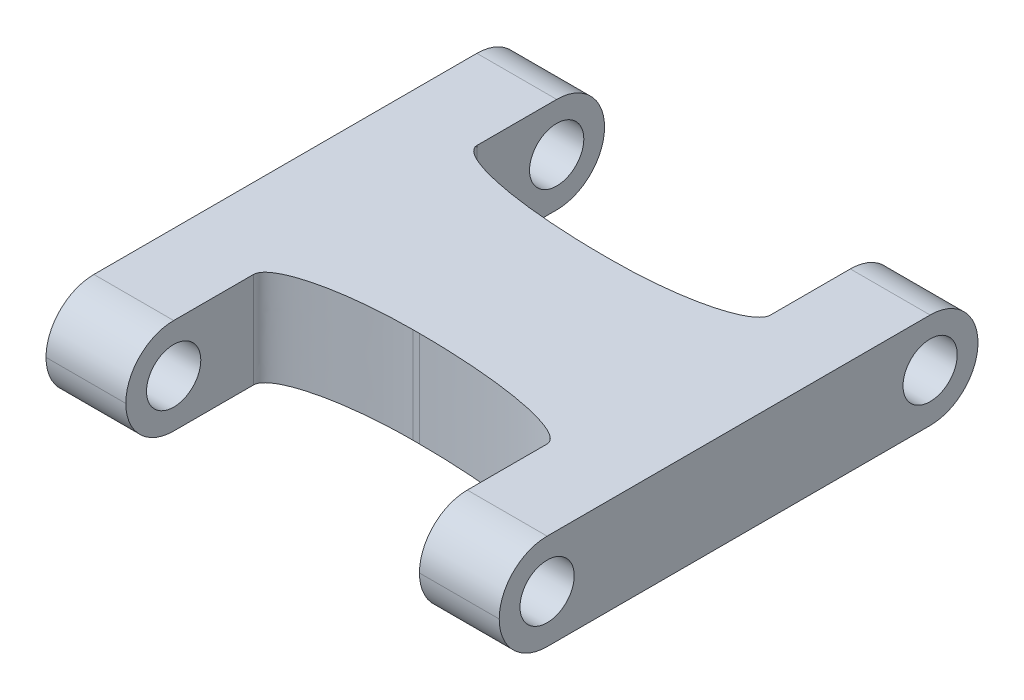
from build123d import *

# Parameters (mm, degrees)
BOSS_EXTRUDE1_DEPTH = 6
FILLET1_R           = 3
SKETCH2_R           = 1.7
CUT_EXTRUDE1_DEPTH  = 42.743981602
FILLET2_SIZE        = 8
FILLET2_SIZE_2      = 2
FILLET3_SIZE        = 2
FILLET3_SIZE_2      = 10


# Some blends are built 0.0001 mm under size
with BuildPart() as part:
    # Sketch1 → Boss-Extrude1 (new body)
    with BuildSketch(Plane(origin=(0, 0, 0), x_dir=(1, 0, 0), z_dir=(0, 1, 0))):
        Polygon((0, 0), (0, 30), (5, 30), (5, 20), (23.4, 20), (23.4, 30), (28.4, 30), (28.4, 0), (23.4, 0), (23.4, 10), (5, 10), (5, 0), align=None)
    extrude(amount=BOSS_EXTRUDE1_DEPTH)

    # Fillet1
    fillet1_edges = [part.edges().sort_by_distance(p)[0] for p in [
        (2.5, 0, -30),
        (2.5, 6, -30),
        (25.9, 0, -30),
        (25.9, 6, -30),
        (2.5, 0, 0),
        (2.5, 6, 0),
        (25.9, 0, 0),
        (25.9, 6, 0),
    ]]
    fillet(fillet1_edges, radius=FILLET1_R - 0.0001)  # a hair under: the kernel refuses the full size

    # Sketch2 → Cut-Extrude1 (cut, through all)
    with BuildSketch(Plane(origin=(28.4, 0, 0), x_dir=(0, 0, -1), z_dir=(1, 0, 0))):
        with Locations((3, 3)):
            Circle(SKETCH2_R)
        with Locations((27, 3)):
            Circle(SKETCH2_R)
    extrude(amount=-CUT_EXTRUDE1_DEPTH, mode=Mode.SUBTRACT)

    # Fillet2
    # an asymmetric fillet: 8, 2 mm, written as the material it adds along each edge
    with BuildSketch(Plane(origin=(23.4, 0, -20), x_dir=(-1, 0, 0), z_dir=(0, 1, 0))) as fillet2_piece_1:
        with BuildLine():
            Bezier((FILLET2_SIZE, 0), (0, 0), (0, -FILLET2_SIZE_2), weights=[1, 0.707106781, 1])
            Line((0, -FILLET2_SIZE_2), (0, 0))
            Line((0, 0), (FILLET2_SIZE, 0))
        make_face()
    extrude(amount=6)
    with BuildSketch(Plane(origin=(5, 0, -10), x_dir=(0, 0, 1), z_dir=(0, 1, 0))) as fillet2_piece_2:
        with BuildLine():
            Bezier((FILLET2_SIZE_2, 0), (0, 0), (0, FILLET2_SIZE), weights=[1, 0.707106781, 1])
            Line((0, FILLET2_SIZE), (0, 0))
            Line((0, 0), (FILLET2_SIZE_2, 0))
        make_face()
    extrude(amount=6)

    # Fillet3
    # an asymmetric fillet: 10, 2 mm, written as the material it adds along each edge
    with BuildSketch(Plane(origin=(5, 0, -20), x_dir=(0, 0, -1), z_dir=(0, 1, 0))) as fillet3_piece_1:
        with BuildLine():
            Bezier((FILLET3_SIZE, 0), (0, 0), (0, -FILLET3_SIZE_2), weights=[1, 0.707106781, 1])
            Line((0, -FILLET3_SIZE_2), (0, 0))
            Line((0, 0), (FILLET3_SIZE, 0))
        make_face()
    extrude(amount=6)
    with BuildSketch(Plane(origin=(23.4, 0, -10), x_dir=(-1, 0, 0), z_dir=(0, 1, 0))) as fillet3_piece_2:
        with BuildLine():
            Bezier((FILLET3_SIZE_2, 0), (0, 0), (0, FILLET3_SIZE), weights=[1, 0.707106781, 1])
            Line((0, FILLET3_SIZE), (0, 0))
            Line((0, 0), (FILLET3_SIZE_2, 0))
        make_face()
    extrude(amount=6)


solid = part.part
